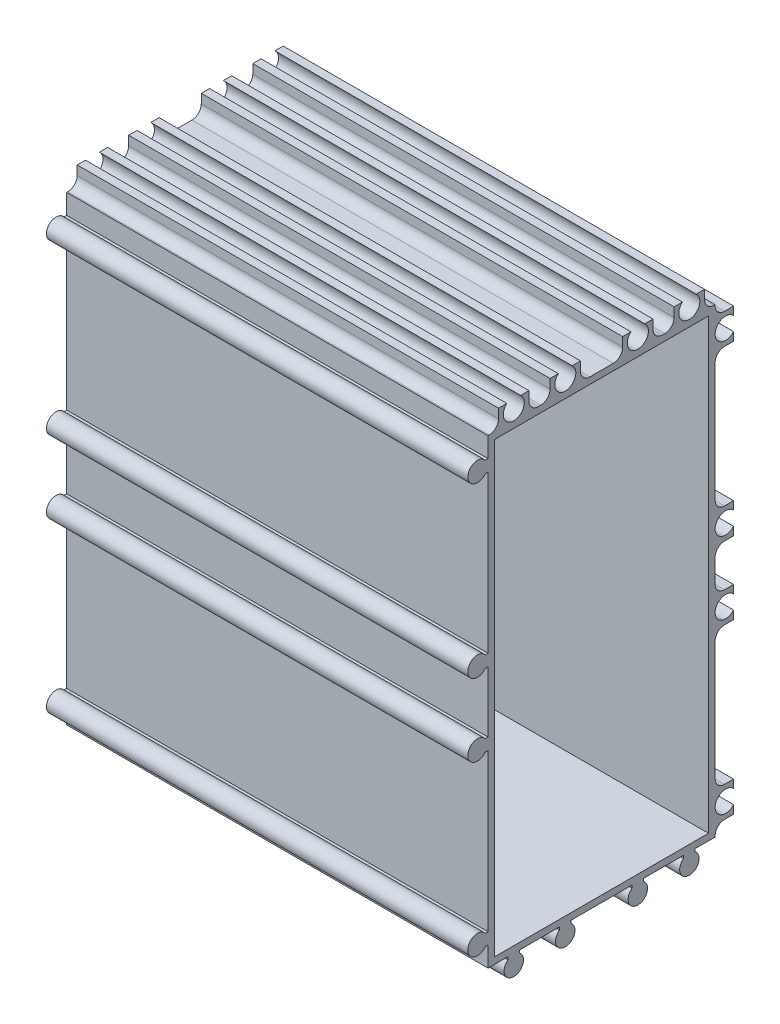
from build123d import *

# Parameters (mm, degrees)
EXTRUDE_1_DEPTH             = 90
SKETCH_2_W                  = 90
SKETCH_2_H                  = 44.25
EXTRUDE_2_DEPTH             = 8.2
SKETCH_3_W                  = 90
SKETCH_3_H                  = 102.45
EXTRUDE_3_DEPTH             = 8.2
SKETCH_4_W                  = 4.5
SKETCH_4_H                  = 3.95
CUT_EXTRUDE_1_DEPTH         = 344.594867722
SKETCH_5_W                  = 2.25
SKETCH_5_H                  = 3.95
CUT_EXTRUDE_2_DEPTH         = 344.594867722
SKETCH_6_W                  = 3.95
SKETCH_6_H                  = 2.25
CUT_EXTRUDE_3_DEPTH         = 344.594867722
SKETCH_7_W                  = 3.95
SKETCH_7_H                  = 29.5
CUT_EXTRUDE_4_DEPTH         = 344.594867722
SKETCH_8_W                  = 3.95
SKETCH_8_H                  = 9
CUT_EXTRUDE_5_DEPTH         = 344.594867722
SKETCH_9_W                  = 3.95
SKETCH_9_H                  = 29.5
CUT_EXTRUDE_6_DEPTH         = 344.594867722
SKETCH_10_W                 = 3.95
SKETCH_10_H                 = 6.2
CUT_EXTRUDE_7_DEPTH         = 344.594867722
SKETCH_11_W                 = 2.25
SKETCH_11_H                 = 3.95
CUT_EXTRUDE_8_DEPTH         = 344.594867722
SKETCH_12_W                 = 4.5
SKETCH_12_H                 = 3.95
CUT_EXTRUDE_9_DEPTH         = 344.594867722
SKETCH_13_W                 = 9
SKETCH_13_H                 = 3.95
CUT_EXTRUDE_10_DEPTH        = 344.594867722
SKETCH_14_W                 = 45.7
SKETCH_14_H                 = 95.7
CUT_EXTRUDE_11_DEPTH        = 86
HOLE_WIZARD_2_5_2_5_1_D     = 2.5
HOLE_WIZARD_4_5_4_5_1_D     = 4.5
HOLE_WIZARD_8_3_8_3_1_D     = 8.3
HOLE_WIZARD_8_3_8_3_1_DEPTH = 3.2
CUT_EXTRUDE_START           = -10
SKETCH_21_R                 = 4.15
CUT_EXTRUDE_12_DEPTH        = 10
SKETCH_22_R                 = 1.631577579
SKETCH_22_R_2               = 1.519375383
SKETCH_22_R_3               = 1.487580747
SKETCH_22_R_4               = 1.581735942
SKETCH_22_R_5               = 1.487835557
SKETCH_22_R_6               = 1.42600834
SKETCH_22_R_7               = 1.628129915
SKETCH_22_R_8               = 1.52367125
EXTRUDE_4_DEPTH             = 90
FILLET_1_R                  = 2
FILLET_2_R                  = 2
FILLET_3_R                  = 2
FILLET_4_R                  = 2
FILLET_5_R                  = 2
FILLET_6_R                  = 2
FILLET_7_R                  = 2
FILLET_8_R                  = 2
FILLET_9_R                  = 2
FILLET_10_R                 = 2
FILLET_11_R                 = 2
FILLET_12_R                 = 2
FILLET_13_R                 = 2
FILLET_14_R                 = 2
FILLET_15_R                 = 2
FILLET_16_R                 = 2
FILLET_17_R                 = 2
FILLET_18_R                 = 2
FILLET_19_R                 = 2
FILLET_20_R                 = 2


with BuildPart() as part:
    # Эскиз1 → Бобышка-Вытянуть1 (new body)
    with BuildSketch(Plane(origin=(90, 0, 0), x_dir=(0, 0, -1), z_dir=(1, 0, 0))):
        with BuildLine():
            Line((6.75, 225.906238208), (6.75, 320.75))
            Line((6.75, 320.75), (-38.093761792, 320.75))
            ThreePointArc((-38.093761792, 320.75), (-41.825, 319.5), (-38.093761792, 318.25))
            Line((-38.093761792, 318.25), (-37.5, 318.25))
            Line((-37.5, 318.25), (-37.5, 284.75))
            Line((-37.5, 284.75), (-38.093761792, 284.75))
            ThreePointArc((-38.093761792, 284.75), (-41.825, 283.5), (-38.093761792, 282.25))
            Line((-38.093761792, 282.25), (-37.5, 282.25))
            Line((-37.5, 282.25), (-37.5, 269.25))
            Line((-37.5, 269.25), (-38.093761792, 269.25))
            ThreePointArc((-38.093761792, 269.25), (-41.825, 268), (-38.093761792, 266.75))
            Line((-38.093761792, 266.75), (-37.5, 266.75))
            Line((-37.5, 266.75), (-37.5, 233.25))
            Line((-37.5, 233.25), (-38.093761792, 233.25))
            ThreePointArc((-38.093761792, 233.25), (-41.825, 232), (-38.093761792, 230.75))
            Line((-38.093761792, 230.75), (-37.5, 230.75))
            Line((-37.5, 230.75), (-37.5, 226.5))
            Line((-37.5, 226.5), (-33.25, 226.5))
            Line((-33.25, 226.5), (-33.25, 225.906238208))
            ThreePointArc((-33.25, 225.906238208), (-32, 222.175), (-30.75, 225.906238208))
            Line((-30.75, 225.906238208), (-30.75, 226.5))
            Line((-30.75, 226.5), (-22.25, 226.5))
            Line((-22.25, 226.5), (-22.25, 225.906238208))
            ThreePointArc((-22.25, 225.906238208), (-21, 222.175), (-19.75, 225.906238208))
            Line((-19.75, 225.906238208), (-19.75, 226.5))
            Line((-19.75, 226.5), (-6.75, 226.5))
            Line((-6.75, 226.5), (-6.75, 225.906238208))
            ThreePointArc((-6.75, 225.906238208), (-5.5, 222.175), (-4.25, 225.906238208))
            Line((-4.25, 225.906238208), (-4.25, 226.5))
            Line((-4.25, 226.5), (4.25, 226.5))
            Line((4.25, 226.5), (4.25, 225.906238208))
            ThreePointArc((4.25, 225.906238208), (5.5, 222.175), (6.75, 225.906238208))
        make_face()
    extrude(amount=-EXTRUDE_1_DEPTH)

    # Эскиз2 → Бобышка-Вытянуть2 (add)
    with BuildSketch(Plane(origin=(0, 320.75, 0), x_dir=(-1, 0, 0), z_dir=(0, 1, 0))):
        with Locations((-45, 15.375)):
            Rectangle(SKETCH_2_W, SKETCH_2_H)
    extrude(amount=EXTRUDE_2_DEPTH)

    # Эскиз3 → Бобышка-Вытянуть3 (add)
    with BuildSketch(Plane(origin=(0, 0, -6.75), x_dir=(-1, 0, 0), z_dir=(0, 0, -1))):
        with Locations((-45, 277.725)):
            Rectangle(SKETCH_3_W, SKETCH_3_H)
    extrude(amount=EXTRUDE_3_DEPTH)

    # Эскиз4 → Вырез-Вытянуть1 (cut, through all)
    with BuildSketch(Plane.ZY):
        with Locations((26.5, 326.975)):
            Rectangle(SKETCH_4_W, SKETCH_4_H)
    extrude(amount=-CUT_EXTRUDE_1_DEPTH, mode=Mode.SUBTRACT)

    # Эскиз5 → Вырез-Вытянуть2 (cut, through all)
    with BuildSketch(Plane.ZY):
        with Locations((36.375, 326.975)):
            Rectangle(SKETCH_5_W, SKETCH_5_H)
    extrude(amount=-CUT_EXTRUDE_2_DEPTH, mode=Mode.SUBTRACT)

    # Эскиз6 → Вырез-Вытянуть3 (cut, through all)
    with BuildSketch(Plane.ZY):
        with Locations((-12.975, 227.625)):
            Rectangle(SKETCH_6_W, SKETCH_6_H)
    extrude(amount=-CUT_EXTRUDE_3_DEPTH, mode=Mode.SUBTRACT)

    # Эскиз7 → Вырез-Вытянуть4 (cut, through all)
    with BuildSketch(Plane.ZY):
        with Locations((-12.975, 250)):
            Rectangle(SKETCH_7_W, SKETCH_7_H)
    extrude(amount=-CUT_EXTRUDE_4_DEPTH, mode=Mode.SUBTRACT)

    # Эскиз8 → Вырез-Вытянуть5 (cut, through all)
    with BuildSketch(Plane.ZY):
        with Locations((-12.975, 275.75)):
            Rectangle(SKETCH_8_W, SKETCH_8_H)
    extrude(amount=-CUT_EXTRUDE_5_DEPTH, mode=Mode.SUBTRACT)

    # Эскиз9 → Вырез-Вытянуть6 (cut, through all)
    with BuildSketch(Plane.ZY):
        with Locations((-12.975, 301.5)):
            Rectangle(SKETCH_9_W, SKETCH_9_H)
    extrude(amount=-CUT_EXTRUDE_6_DEPTH, mode=Mode.SUBTRACT)

    # Эскиз10 → Вырез-Вытянуть7 (cut, through all)
    with BuildSketch(Plane.ZY):
        with Locations((-12.975, 325.85)):
            Rectangle(SKETCH_10_W, SKETCH_10_H)
    extrude(amount=-CUT_EXTRUDE_7_DEPTH, mode=Mode.SUBTRACT)

    # Эскиз11 → Вырез-Вытянуть8 (cut, through all)
    with BuildSketch(Plane.ZY):
        with Locations((-9.875, 326.975)):
            Rectangle(SKETCH_11_W, SKETCH_11_H)
    extrude(amount=-CUT_EXTRUDE_8_DEPTH, mode=Mode.SUBTRACT)

    # Эскиз12 → Вырез-Вытянуть9 (cut, through all)
    with BuildSketch(Plane.ZY):
        with Locations((0, 326.975)):
            Rectangle(SKETCH_12_W, SKETCH_12_H)
    extrude(amount=-CUT_EXTRUDE_9_DEPTH, mode=Mode.SUBTRACT)

    # Эскиз13 → Вырез-Вытянуть10 (cut, through all)
    with BuildSketch(Plane.ZY):
        with Locations((13.25, 326.975)):
            Rectangle(SKETCH_13_W, SKETCH_13_H)
    extrude(amount=-CUT_EXTRUDE_10_DEPTH, mode=Mode.SUBTRACT)

    # Эскиз14 → Вырез-Вытянуть11 (cut)
    with BuildSketch(Plane(origin=(90, 0, 0), x_dir=(0, 0, -1), z_dir=(1, 0, 0))):
        with Locations((-13.25, 275.75)):
            Rectangle(SKETCH_14_W, SKETCH_14_H)
    extrude(amount=-CUT_EXTRUDE_11_DEPTH, mode=Mode.SUBTRACT)

    # Диаметр отверстия Ø2.5 (2.5)1 (through all)
    with Locations(Plane(origin=(90, 0, 0), x_dir=(0, 0, -1), z_dir=(1, 0, 0))):
        with Locations((-39.75, 232), (-21, 224.25), (-39.75, 283.5), (-5.5, 224.25), (5.5, 224.25), (-39.75, 319.5), (-39.75, 268), (-32, 224.25)):
            Hole(HOLE_WIZARD_2_5_2_5_1_D / 2)

    # Диаметр отверстия Ø4.5 (4.5)1 (through all)
    with Locations(Plane.ZY):
        with Locations((21, 327.25), (32, 327.25), (-13.25, 232), (-13.25, 268), (-13.25, 283.5), (-13.25, 319.5), (-5.5, 327.25), (5.5, 327.25)):
            Hole(HOLE_WIZARD_4_5_4_5_1_D / 2)

    # Диаметр отверстия Ø8.3 (8.3)1
    with Locations(Plane.ZY):
        with Locations((13.25, 275.75)):
            Hole(HOLE_WIZARD_8_3_8_3_1_D / 2, depth=HOLE_WIZARD_8_3_8_3_1_DEPTH)

    # Эскиз21 → Вырез-Вытянуть12 (cut)
    with BuildSketch(Plane.ZY.offset(CUT_EXTRUDE_START)):
        with Locations((13.25, 275.75)):
            Circle(SKETCH_21_R)
    extrude(amount=CUT_EXTRUDE_12_DEPTH, mode=Mode.SUBTRACT)

    # Эскиз22 → Бобышка-Вытянуть4 (add)
    with BuildSketch(Plane(origin=(90, 0, 0), x_dir=(0, 0, -1), z_dir=(1, 0, 0))):
        with Locations((-39.75, 319.5)):
            Circle(SKETCH_22_R)
        with Locations((-39.75, 283.5)):
            Circle(SKETCH_22_R_2)
        with Locations((-39.75, 268)):
            Circle(SKETCH_22_R_3)
        with Locations((-39.75, 232)):
            Circle(SKETCH_22_R_4)
        with Locations((-32, 224.25)):
            Circle(SKETCH_22_R_5)
        with Locations((-21, 224.25)):
            Circle(SKETCH_22_R_6)
        with Locations((-5.5, 224.25)):
            Circle(SKETCH_22_R_7)
        with Locations((5.5, 224.25)):
            Circle(SKETCH_22_R_8)
    extrude(amount=-EXTRUDE_4_DEPTH)

    # Скругление1
    fillet_1_edges = [part.edges().sort_by_distance(p)[0] for p in [
        (4, 275.75, -9.6),
    ]]
    fillet(fillet_1_edges, radius=FILLET_1_R)

    # Скругление2
    fillet_2_edges = [part.edges().sort_by_distance(p)[0] for p in [
        (4, 275.75, 36.1),
    ]]
    fillet(fillet_2_edges, radius=FILLET_2_R)

    # Скругление3
    # the kernel refuses this fillet: 2 mm, written as the material it adds along each edge
    with BuildSketch(Plane(origin=(4, 323.6, -12.6), x_dir=(1, 0, 0), z_dir=(0, 0, 1))) as fillet_3_piece_1_section:
        with BuildLine():
            CenterArc((FILLET_3_R, -FILLET_3_R), FILLET_3_R, 90, 90)
            Line((0, -FILLET_3_R), (0, 0))
            Line((0, 0), (FILLET_3_R, 0))
        make_face()
    fillet_3_piece_1 = extrude(amount=51.7, mode=Mode.PRIVATE)
    fillet_3_piece_1 = split(fillet_3_piece_1, bisect_by=Plane(origin=(4.637124426, 323.319344088, -11), z_dir=(0, 0, 1)), keep=Keep.TOP, mode=Mode.PRIVATE)
    fillet_3_piece_1 = split(fillet_3_piece_1, bisect_by=Plane(origin=(4.637124426, 323.319344088, 37.5), z_dir=(0, 0, -1)), keep=Keep.TOP, mode=Mode.PRIVATE)
    add(fillet_3_piece_1)

    # Скругление4
    # the kernel refuses this fillet: 2 mm, written as the material it adds along each edge
    with BuildSketch(Plane(origin=(4, 227.9, 39.1), x_dir=(0, 1, 0), z_dir=(0, 0, -1))) as fillet_4_piece_1_section:
        with BuildLine():
            CenterArc((FILLET_4_R, FILLET_4_R), FILLET_4_R, 180, 90)
            Line((0, FILLET_4_R), (0, 0))
            Line((0, 0), (FILLET_4_R, 0))
        make_face()
    fillet_4_piece_1 = extrude(amount=51.7, mode=Mode.PRIVATE)
    fillet_4_piece_1 = split(fillet_4_piece_1, bisect_by=Plane(origin=(4.14263726, 228.974904064, -11), z_dir=(0, 0, 1)), keep=Keep.TOP, mode=Mode.PRIVATE)
    fillet_4_piece_1 = split(fillet_4_piece_1, bisect_by=Plane(origin=(4.14263726, 228.974904064, 37.5), z_dir=(0, 0, -1)), keep=Keep.TOP, mode=Mode.PRIVATE)
    add(fillet_4_piece_1)

    # Скругление5
    fillet_5_edges = [part.edges().sort_by_distance(p)[0] for p in [
        (45, 325, 35.25),
    ]]
    fillet(fillet_5_edges, radius=FILLET_5_R)

    # Скругление6
    fillet_6_edges = [part.edges().sort_by_distance(p)[0] for p in [
        (45, 325, 28.75),
    ]]
    fillet(fillet_6_edges, radius=FILLET_6_R)

    # Скругление7
    fillet_7_edges = [part.edges().sort_by_distance(p)[0] for p in [
        (45, 325, 24.25),
    ]]
    fillet(fillet_7_edges, radius=FILLET_7_R)

    # Скругление8
    fillet_8_edges = [part.edges().sort_by_distance(p)[0] for p in [
        (45, 325, 17.75),
    ]]
    fillet(fillet_8_edges, radius=FILLET_8_R)

    # Скругление9
    fillet_9_edges = [part.edges().sort_by_distance(p)[0] for p in [
        (45, 325, 8.75),
    ]]
    fillet(fillet_9_edges, radius=FILLET_9_R)

    # Скругление10
    fillet_10_edges = [part.edges().sort_by_distance(p)[0] for p in [
        (45, 325, 2.25),
    ]]
    fillet(fillet_10_edges, radius=FILLET_10_R)

    # Скругление11
    fillet_11_edges = [part.edges().sort_by_distance(p)[0] for p in [
        (45, 325, -2.25),
    ]]
    fillet(fillet_11_edges, radius=FILLET_11_R)

    # Скругление12
    fillet_12_edges = [part.edges().sort_by_distance(p)[0] for p in [
        (45, 325, -8.75),
    ]]
    fillet(fillet_12_edges, radius=FILLET_12_R)

    # Скругление13
    fillet_13_edges = [part.edges().sort_by_distance(p)[0] for p in [
        (45, 322.75, -11),
    ]]
    fillet(fillet_13_edges, radius=FILLET_13_R)

    # Скругление14
    fillet_14_edges = [part.edges().sort_by_distance(p)[0] for p in [
        (45, 316.25, -11),
    ]]
    fillet(fillet_14_edges, radius=FILLET_14_R)

    # Скругление15
    fillet_15_edges = [part.edges().sort_by_distance(p)[0] for p in [
        (45, 286.75, -11),
    ]]
    fillet(fillet_15_edges, radius=FILLET_15_R)

    # Скругление16
    fillet_16_edges = [part.edges().sort_by_distance(p)[0] for p in [
        (45, 280.25, -11),
    ]]
    fillet(fillet_16_edges, radius=FILLET_16_R)

    # Скругление17
    fillet_17_edges = [part.edges().sort_by_distance(p)[0] for p in [
        (45, 271.25, -11),
    ]]
    fillet(fillet_17_edges, radius=FILLET_17_R)

    # Скругление18
    fillet_18_edges = [part.edges().sort_by_distance(p)[0] for p in [
        (45, 264.75, -11),
    ]]
    fillet(fillet_18_edges, radius=FILLET_18_R)

    # Скругление19
    fillet_19_edges = [part.edges().sort_by_distance(p)[0] for p in [
        (45, 235.25, -11),
    ]]
    fillet(fillet_19_edges, radius=FILLET_19_R)

    # Скругление20
    fillet_20_edges = [part.edges().sort_by_distance(p)[0] for p in [
        (45, 228.75, -11),
    ]]
    fillet(fillet_20_edges, radius=FILLET_20_R)


solid = part.part
